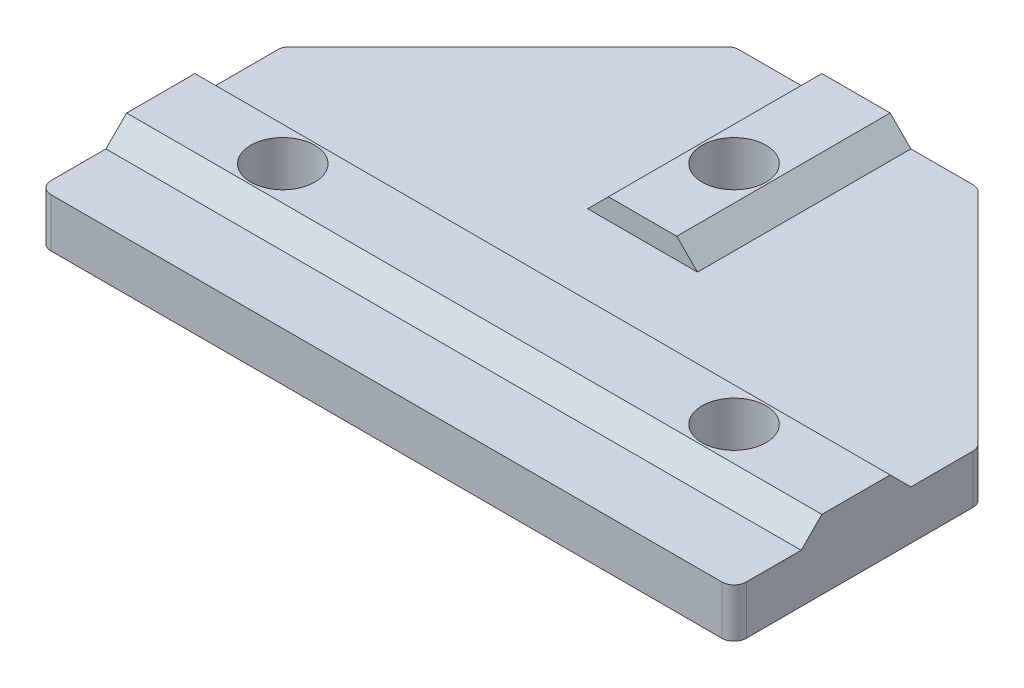
from build123d import *

# Parameters (mm, degrees)
BOSS_EXTRUDE1_DEPTH = 4
SKETCH2_W           = 9
SKETCH2_H           = 17.5
SKETCH2_W_2         = 57
SKETCH2_H_2         = 9
BOSS_EXTRUDE2_DEPTH = 1.7
CHAMFER1_SIZE       = 1.7
SKETCH4_R           = 2.625
CUT_EXTRUDE1_DEPTH  = 70.019852217
FILLET1_R           = 1


with BuildPart() as part:
    # Sketch1 → Boss-Extrude1 (new body)
    with BuildSketch(Plane(origin=(0, 0, 0), x_dir=(1, 0, 0), z_dir=(0, 1, 0))):
        Polygon((0, 0), (57, 0), (57, 20), (38.5, 38.5), (18.5, 38.5), (0, 20), align=None)
    extrude(amount=BOSS_EXTRUDE1_DEPTH)

    # Sketch2 → Boss-Extrude2 (add)
    with BuildSketch(Plane(origin=(0, 4, 0), x_dir=(1, 0, 0), z_dir=(0, 1, 0))):
        with Locations((28.5, 29.75)):
            Rectangle(SKETCH2_W, SKETCH2_H)
        with Locations((28.5, 10)):
            Rectangle(SKETCH2_W_2, SKETCH2_H_2)
    extrude(amount=BOSS_EXTRUDE2_DEPTH)

    # Chamfer1
    chamfer1_edges = [part.edges().sort_by_distance(p)[0] for p in [
        (33, 5.7, -29.75),
        (28.5, 5.7, -14.5),
        (24, 5.7, -29.75),
        (28.5, 5.7, -5.5),
    ]]
    chamfer(chamfer1_edges, length=CHAMFER1_SIZE - 0.0001)  # a hair under: the kernel refuses the full size

    # Sketch4 → Cut-Extrude1 (cut, through all)
    with BuildSketch(Plane.XZ):
        with Locations(Location((10, -10, 0), (0, 0, 270))):
            Circle(SKETCH4_R)
        with Locations(Location((47, -10, 0), (0, 0, 270))):
            Circle(SKETCH4_R)
        with Locations(Location((28.5, -28.5, 0), (0, 0, 270))):
            Circle(SKETCH4_R)
    extrude(amount=-CUT_EXTRUDE1_DEPTH, mode=Mode.SUBTRACT)

    # Fillet1
    fillet1_edges = [part.edges().sort_by_distance(p)[0] for p in [
        (0, 2, -20),
        (18.5, 2, -38.5),
        (38.5, 2, -38.5),
        (57, 2, -20),
        (57, 2, 0),
        (0, 2, 0),
    ]]
    fillet(fillet1_edges, radius=FILLET1_R)


solid = part.part
